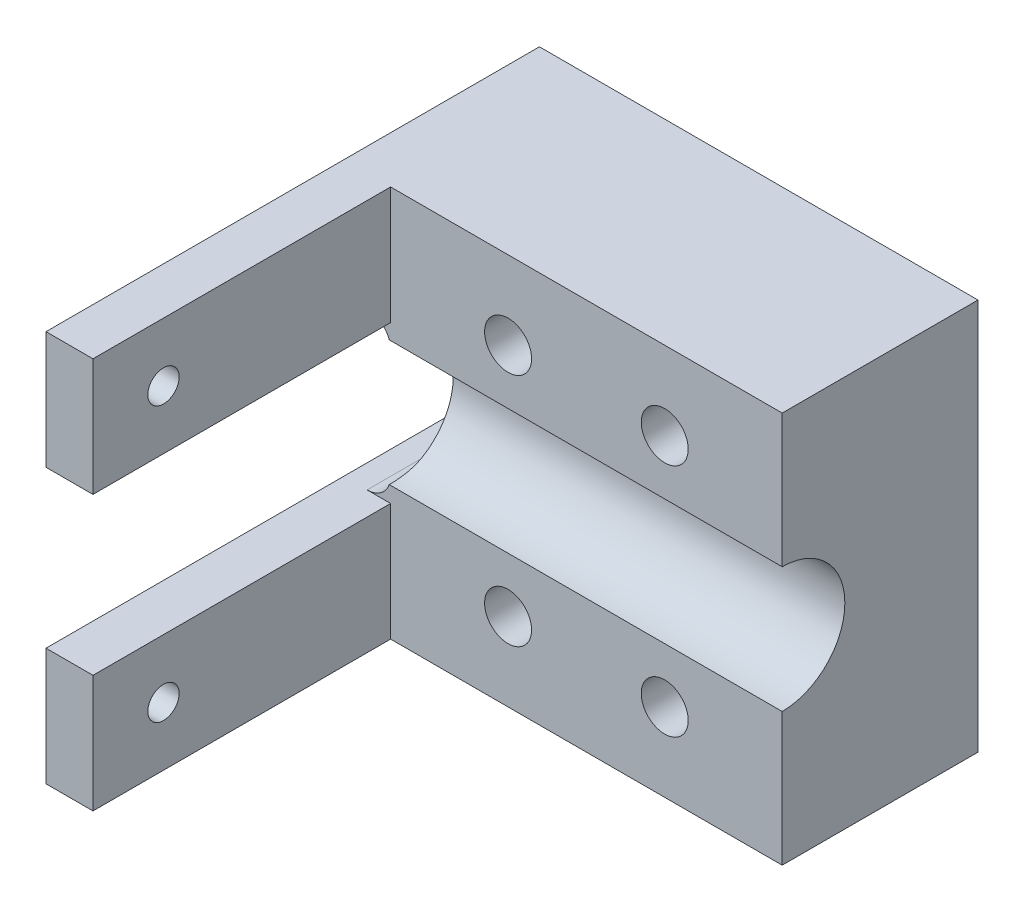
from build123d import *

# Parameters (mm, degrees)
SKETCH1_W           = 50
SKETCH1_H           = 50
BOSS_EXTRUDE1_DEPTH = 25
SKETCH2_R           = 8
CUT_EXTRUDE1_DEPTH  = 58
SKETCH3_R           = 3
CUT_EXTRUDE2_DEPTH  = 25
SKETCH4_W           = 63
SKETCH4_H           = 15
BOSS_EXTRUDE2_DEPTH = 6
SKETCH5_R           = 2
CUT_EXTRUDE3_DEPTH  = 6
CHAMFER1_SIZE       = 2.5
FILLET1_R           = 3


with BuildPart() as part:
    # Sketch1 → Boss-Extrude1 (new body)
    with BuildSketch(Plane.XY):
        with Locations((25, 25)):
            Rectangle(SKETCH1_W, SKETCH1_H)
    extrude(amount=BOSS_EXTRUDE1_DEPTH)

    # Sketch2 → Cut-Extrude1 (cut)
    with BuildSketch(Plane.ZY):
        with Locations((25, 25)):
            Circle(SKETCH2_R)
    extrude(amount=-CUT_EXTRUDE1_DEPTH, mode=Mode.SUBTRACT)

    # Sketch3 → Cut-Extrude2 (cut)
    with BuildSketch(Plane.XY.offset(25)):
        with Locations((15, 40)):
            Circle(SKETCH3_R)
        with Locations((35, 40)):
            Circle(SKETCH3_R)
        with Locations((35, 10)):
            Circle(SKETCH3_R)
        with Locations((15, 10)):
            Circle(SKETCH3_R)
    extrude(amount=-CUT_EXTRUDE2_DEPTH, mode=Mode.SUBTRACT)

    # Sketch4 → Boss-Extrude2 (add)
    with BuildSketch(Plane.ZY):
        with Locations((31.5, 42.5)):
            Rectangle(SKETCH4_W, SKETCH4_H)
        with Locations((31.5, 7.5)):
            Rectangle(SKETCH4_W, SKETCH4_H)
    extrude(amount=BOSS_EXTRUDE2_DEPTH)

    # Sketch5 → Cut-Extrude3 (cut)
    with BuildSketch(Plane.ZY.offset(6)):
        with Locations((54, 42.5)):
            Circle(SKETCH5_R)
        with Locations((54, 7.5)):
            Circle(SKETCH5_R)
    extrude(amount=-CUT_EXTRUDE3_DEPTH, mode=Mode.SUBTRACT)

    # Chamfer1
    chamfer1_edges = [part.edges().sort_by_distance(p)[0] for p in [
        (-6, 42.5, 52),
        (-6, 7.5, 52),
    ]]
    chamfer(chamfer1_edges, length=CHAMFER1_SIZE)

    # Fillet1
    # the kernel refuses this fillet: 3 mm, written as the material it adds along each edge
    with BuildSketch(Plane(origin=(0, 15, 25), x_dir=(-1, 0, 0), z_dir=(0, 0, -1))) as fillet1_piece_1_section:
        with BuildLine():
            CenterArc((FILLET1_R, FILLET1_R), FILLET1_R, 180, 90)
            Line((0, FILLET1_R), (0, 0))
            Line((0, 0), (FILLET1_R, 0))
        make_face()
    fillet1_piece_1 = extrude(amount=25, mode=Mode.PRIVATE)
    fillet1_piece_1 = fillet1_piece_1 - Plane(origin=(-0.671433756, 25, 25), x_dir=(0, 0, 1), z_dir=(-1, 0, 0)) * Cylinder(8, 62, mode=Mode.PRIVATE)
    add(fillet1_piece_1)
    with BuildSketch(Plane(origin=(0, 35, 25), x_dir=(-1, 0, 0), z_dir=(0, 0, -1))) as fillet1_piece_2_section:
        with BuildLine():
            CenterArc((FILLET1_R, -FILLET1_R), FILLET1_R, 90, 90)
            Line((0, -FILLET1_R), (0, 0))
            Line((0, 0), (FILLET1_R, 0))
        make_face()
    fillet1_piece_2 = extrude(amount=25, mode=Mode.PRIVATE)
    fillet1_piece_2 = fillet1_piece_2 - Plane(origin=(-0.671433756, 25, 25), x_dir=(0, 0, 1), z_dir=(-1, 0, 0)) * Cylinder(8, 62, mode=Mode.PRIVATE)
    add(fillet1_piece_2)


solid = part.part
